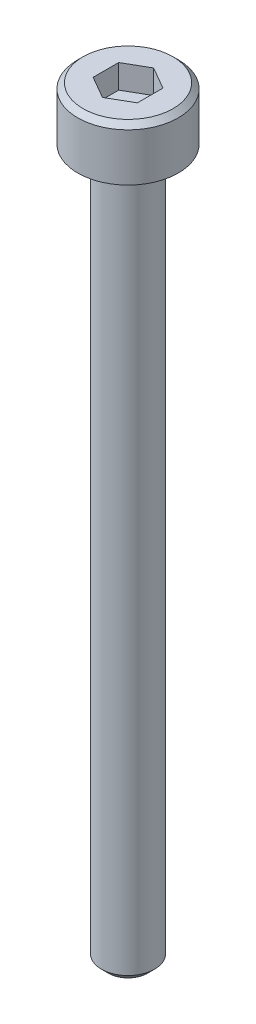
from build123d import *

# Parameters (mm, degrees)
CUT_EXTRUDE1_DEPTH = 1.35


with BuildPart() as part:
    # Sketch1 → Revolve1 (revolve)
    with BuildSketch(Plane.XY):
        Polygon((0, -40), (1.1, -40), (1.5, -39.6), (1.5, 0), (2.84, 0), (2.84, 2.7), (2.54, 3), (0, 3), align=None)
    revolve(axis=Axis((0, -10, 0), (0, 1, 0)))

    # Sketch2 → Cut-Extrude1 (cut)
    with BuildSketch(Plane(origin=(0, 3, 0), x_dir=(1, 0, 0), z_dir=(0, 1, 0))):
        Polygon((1.25, -0.721687836), (0, -1.443375673), (-1.25, -0.721687836), (-1.25, 0.721687836), (0, 1.443375673), (1.25, 0.721687836), align=None)
    extrude(amount=-CUT_EXTRUDE1_DEPTH, mode=Mode.SUBTRACT)


solid = part.part
